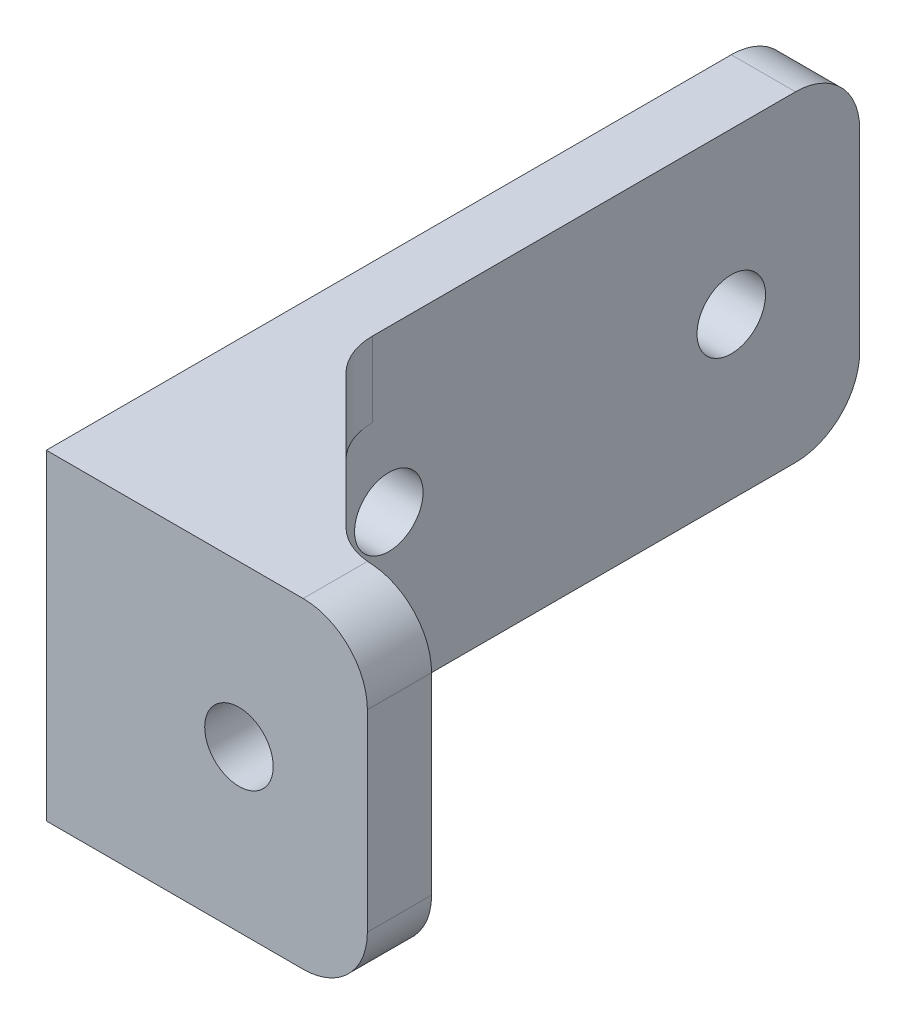
from build123d import *

# Parameters (mm, degrees)
SKETCH1_W           = 3
SKETCH1_H           = 32
SKETCH1_H_2         = 3
SKETCH1_W_2         = 12
BOSS_EXTRUDE1_DEPTH = 15
SKETCH2_R           = 1.6
CUT_EXTRUDE1_DEPTH  = 39.392707641
SKETCH3_R           = 1.6
CUT_EXTRUDE2_DEPTH  = 40.924929555
FILLET1_R           = 3
CHAMFER1_SIZE       = 8
SKETCH6_W           = 8
SKETCH6_H           = 8
CUT_EXTRUDE5_DEPTH  = 12
FILLET2_R           = 3


with BuildPart() as part:
    # Sketch1 → Boss-Extrude1 (new body)
    with BuildSketch(Plane(origin=(0, 0, 0), x_dir=(1, 0, 0), z_dir=(0, 1, 0))):
        with Locations((1.5, 19)):
            Rectangle(SKETCH1_W, SKETCH1_H)
        with Locations((1.5, 1.5)):
            Rectangle(SKETCH1_W, SKETCH1_H_2)
        with Locations((9, 1.5)):
            Rectangle(SKETCH1_W_2, SKETCH1_H_2)
    extrude(amount=BOSS_EXTRUDE1_DEPTH)

    # Sketch2 → Cut-Extrude1 (cut, through all)
    with BuildSketch(Plane(origin=(0, 0, -3), x_dir=(-1, 0, 0), z_dir=(0, 0, -1))):
        with Locations((-9, 7.5)):
            Circle(SKETCH2_R)
    extrude(amount=-CUT_EXTRUDE1_DEPTH, mode=Mode.SUBTRACT)

    # Sketch3 → Cut-Extrude2 (cut, through all)
    with BuildSketch(Plane(origin=(3, 0, 0), x_dir=(0, 0, -1), z_dir=(1, 0, 0))):
        with Locations((13, 7.5)):
            Circle(SKETCH3_R)
        with Locations((29, 7.5)):
            Circle(SKETCH3_R)
    extrude(amount=-CUT_EXTRUDE2_DEPTH, mode=Mode.SUBTRACT)

    # Fillet1
    fillet1_edges = [part.edges().sort_by_distance(p)[0] for p in [
        (15, 15, -1.5),
        (1.5, 15, -35),
        (1.5, 0, -35),
        (15, 0, -1.5),
    ]]
    fillet(fillet1_edges, radius=FILLET1_R)

    # Chamfer1
    # the kernel refuses this chamfer: 8 mm, written as the material it adds along each edge
    with BuildSketch(Plane(origin=(3, 0, -3), x_dir=(-0.027495876610586382, 0, -0.9996219169112968), z_dir=(0, 1, 0))) as chamfer1_piece_1_section:
        Polygon((CHAMFER1_SIZE * 0.999621916911, -CHAMFER1_SIZE * 0.0274958766106), (-CHAMFER1_SIZE * 0.0274958766106, -CHAMFER1_SIZE * 0.999621916911), (0, 0), align=None)
    chamfer1_piece_1 = extrude(amount=15, mode=Mode.PRIVATE)
    chamfer1_piece_1 = chamfer1_piece_1 - Plane(origin=(9, 7.5, -5.695402836), x_dir=(-1, 0, 0), z_dir=(0, 0, -1)) * Cylinder(1.6, 62, mode=Mode.PRIVATE)
    add(chamfer1_piece_1)

    # Sketch6 → Cut-Extrude5 (cut)
    with BuildSketch(Plane(origin=(15, 0, 0), x_dir=(0, 0, -1), z_dir=(1, 0, 0))):
        with Locations((7, 7.5)):
            Rectangle(SKETCH6_W, SKETCH6_H)
    extrude(amount=-CUT_EXTRUDE5_DEPTH, mode=Mode.SUBTRACT)

    # Fillet2
    fillet2_edges = [part.edges().sort_by_distance(p)[0] for p in [
        (3, 7.5, -3),
        (11, 1.75, -3),
        (3, 1.75, -11),
        (3, 13.25, -11),
        (11, 13.25, -3),
    ]]
    fillet(fillet2_edges, radius=FILLET2_R)


solid = part.part
